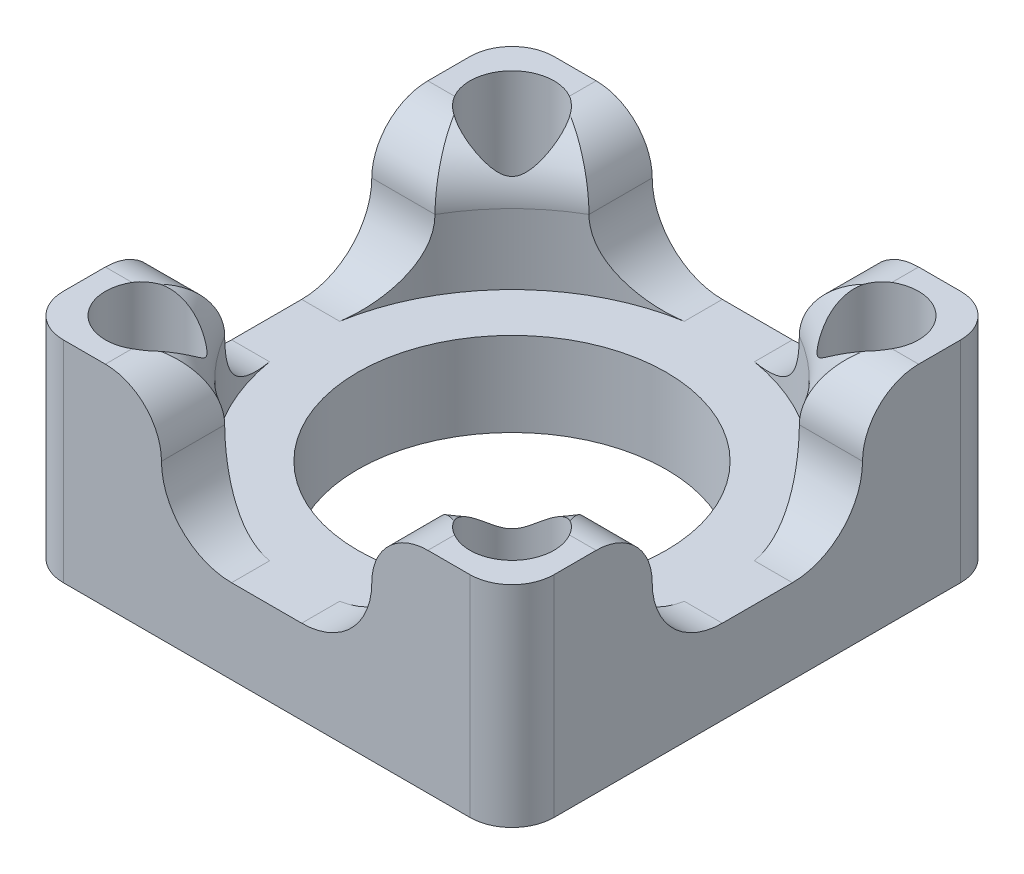
from build123d import *

# Parameters (mm, degrees)
SKETCH1_W                      = 35
SKETCH1_H                      = 35
BOSS_EXTRUDE1_DEPTH            = 6
FILLET1_R                      = 3
CUT_EXTRUDE1_REACH             = 36.916
SKETCH2_R                      = 2.25
CUT_EXTRUDE1_DIRECTION_2_DEPTH = 35.915958162
CUT_EXTRUDE2_REACH             = 36.916
SKETCH3_R                      = 11
BOSS_EXTRUDE2_START            = 9
SKETCH4_R                      = 15
SKETCH4_R_2                    = 2.25
BOSS_EXTRUDE2_DEPTH            = 9
SKETCH5_W                      = 15
SKETCH5_H                      = 9
CUT_EXTRUDE3_DEPTH             = 44.447559692
SKETCH6_W                      = 15
SKETCH6_H                      = 9
CUT_EXTRUDE4_DEPTH             = 47.855455297
FILLET2_R                      = 4
FILLET3_R                      = 5
SKETCH7_R                      = 3
CUT_EXTRUDE5_DEPTH             = 9


# Some blends are built 0.0001 mm under size
with BuildPart() as part:
    # Sketch1 → Boss-Extrude1 (new body)
    with BuildSketch(Plane(origin=(0, 0, 0), x_dir=(1, 0, 0), z_dir=(0, 1, 0))):
        with Locations((-3.421052632, -9.802631579)):
            Rectangle(SKETCH1_W, SKETCH1_H)
    extrude(amount=BOSS_EXTRUDE1_DEPTH)

    # Fillet1
    fillet1_edges = [part.edges().sort_by_distance(p)[0] for p in [
        (-20.921052632, 3, -7.697368421),
        (14.078947368, 3, -7.697368421),
        (14.078947368, 3, 27.302631579),
        (-20.921052632, 3, 27.302631579),
    ]]
    fillet(fillet1_edges, radius=FILLET1_R)

    # Sketch2 → Cut-Extrude1 (cut, up to next)
    with BuildSketch(Plane(origin=(0, 6, 0), x_dir=(1, 0, 0), z_dir=(0, 1, 0)), mode=Mode.PRIVATE) as cut_extrude1_sk1:
        with Locations(Location((-16.421052632, 3.197368421, 0), (0, 0, 90))):
            Circle(SKETCH2_R)
    cut_extrude1_tool1 = extrude(cut_extrude1_sk1.sketch, amount=-CUT_EXTRUDE1_REACH, mode=Mode.PRIVATE) & part.part
    # Sketch2 → Cut-Extrude1 (cut, up to next)
    with BuildSketch(Plane(origin=(0, 6, 0), x_dir=(1, 0, 0), z_dir=(0, 1, 0)), mode=Mode.PRIVATE) as cut_extrude1_sk2:
        with Locations(Location((9.578947368, 3.197368421, 0), (0, 0, 90))):
            Circle(SKETCH2_R)
    cut_extrude1_tool2 = extrude(cut_extrude1_sk2.sketch, amount=-CUT_EXTRUDE1_REACH, mode=Mode.PRIVATE) & part.part
    # Sketch2 → Cut-Extrude1 (cut, up to next)
    with BuildSketch(Plane(origin=(0, 6, 0), x_dir=(1, 0, 0), z_dir=(0, 1, 0)), mode=Mode.PRIVATE) as cut_extrude1_sk3:
        with Locations(Location((9.578947368, -22.802631579, 0), (0, 0, 90))):
            Circle(SKETCH2_R)
    cut_extrude1_tool3 = extrude(cut_extrude1_sk3.sketch, amount=-CUT_EXTRUDE1_REACH, mode=Mode.PRIVATE) & part.part
    # Sketch2 → Cut-Extrude1 (cut, up to next)
    with BuildSketch(Plane(origin=(0, 6, 0), x_dir=(1, 0, 0), z_dir=(0, 1, 0)), mode=Mode.PRIVATE) as cut_extrude1_sk4:
        with Locations(Location((-16.421052632, -22.802631579, 0), (0, 0, 90))):
            Circle(SKETCH2_R)
    cut_extrude1_tool4 = extrude(cut_extrude1_sk4.sketch, amount=-CUT_EXTRUDE1_REACH, mode=Mode.PRIVATE) & part.part
    add(cut_extrude1_tool1.solids().sort_by_distance((-16.421053, 6, -3.197368))[0], mode=Mode.SUBTRACT)
    add(cut_extrude1_tool2.solids().sort_by_distance((9.578947, 6, -3.197368))[0], mode=Mode.SUBTRACT)
    add(cut_extrude1_tool3.solids().sort_by_distance((9.578947, 6, 22.802632))[0], mode=Mode.SUBTRACT)
    add(cut_extrude1_tool4.solids().sort_by_distance((-16.421053, 6, 22.802632))[0], mode=Mode.SUBTRACT)

    # Sketch2 → Cut-Extrude1 direction 2 (cut)
    with BuildSketch(Plane(origin=(0, 6, 0), x_dir=(1, 0, 0), z_dir=(0, 1, 0))):
        with Locations(Location((-16.421052632, 3.197368421, 0), (0, 0, 90))):
            Circle(SKETCH2_R)
        with Locations(Location((9.578947368, 3.197368421, 0), (0, 0, 90))):
            Circle(SKETCH2_R)
        with Locations(Location((9.578947368, -22.802631579, 0), (0, 0, 90))):
            Circle(SKETCH2_R)
        with Locations(Location((-16.421052632, -22.802631579, 0), (0, 0, 90))):
            Circle(SKETCH2_R)
    extrude(amount=CUT_EXTRUDE1_DIRECTION_2_DEPTH, mode=Mode.SUBTRACT)

    # Sketch3 → Cut-Extrude2 (cut, up to next)
    with BuildSketch(Plane(origin=(0, 6, 0), x_dir=(1, 0, 0), z_dir=(0, 1, 0)), mode=Mode.PRIVATE) as cut_extrude2_sk1:
        with Locations(Location((-3.421052632, -9.802631579, 0), (0, 0, 270))):
            Circle(SKETCH3_R)
    cut_extrude2_tool1 = extrude(cut_extrude2_sk1.sketch, amount=-CUT_EXTRUDE2_REACH, mode=Mode.PRIVATE) & part.part
    add(cut_extrude2_tool1.solids().sort_by_distance((-3.421053, 6, 9.802632))[0], mode=Mode.SUBTRACT)

    # Sketch4 → Boss-Extrude2 (add)
    with BuildSketch(Plane(origin=(0, 6, 0), x_dir=(1, 0, 0), z_dir=(0, 1, 0)).offset(BOSS_EXTRUDE2_START)):
        with BuildLine():
            Line((11.078947368, 7.697368421), (-17.921052632, 7.697368421))
            ThreePointArc((-17.921052632, 7.697368421), (-20.042372975, 6.818688765), (-20.921052632, 4.697368421))
            Line((-20.921052632, 4.697368421), (-20.921052632, -24.302631579))
            ThreePointArc((-20.921052632, -24.302631579), (-20.042372975, -26.423951923), (-17.921052632, -27.302631579))
            Line((-17.921052632, -27.302631579), (11.078947368, -27.302631579))
            ThreePointArc((11.078947368, -27.302631579), (13.200267712, -26.423951923), (14.078947368, -24.302631579))
            Line((14.078947368, -24.302631579), (14.078947368, 4.697368421))
            ThreePointArc((14.078947368, 4.697368421), (13.200267712, 6.818688765), (11.078947368, 7.697368421))
        make_face()
        with Locations(Location((-3.421052632, -9.802631579, 0), (0, 0, 270))):
            Circle(SKETCH4_R, mode=Mode.SUBTRACT)
        with Locations(Location((9.578947368, 3.197368421, 0), (0, 0, 90))):
            Circle(SKETCH4_R_2, mode=Mode.SUBTRACT)
        with Locations(Location((9.578947368, -22.802631579, 0), (0, 0, 90))):
            Circle(SKETCH4_R_2, mode=Mode.SUBTRACT)
        with Locations(Location((-16.421052632, -22.802631579, 0), (0, 0, 90))):
            Circle(SKETCH4_R_2, mode=Mode.SUBTRACT)
        with Locations(Location((-16.421052632, 3.197368421, 0), (0, 0, 90))):
            Circle(SKETCH4_R_2, mode=Mode.SUBTRACT)
    extrude(amount=-BOSS_EXTRUDE2_DEPTH)

    # Sketch5 → Cut-Extrude3 (cut, through all)
    with BuildSketch(Plane.XY.offset(27.302631579)):
        with Locations((-3.421052632, 10.5)):
            Rectangle(SKETCH5_W, SKETCH5_H)
    extrude(amount=-CUT_EXTRUDE3_DEPTH, mode=Mode.SUBTRACT)

    # Sketch6 → Cut-Extrude4 (cut, through all)
    with BuildSketch(Plane.ZY.offset(20.921052632)):
        with Locations((9.802631579, 10.5)):
            Rectangle(SKETCH6_W, SKETCH6_H)
    extrude(amount=-CUT_EXTRUDE4_DEPTH, mode=Mode.SUBTRACT)

    # Fillet2
    # the kernel refuses this fillet: 4 mm, written as the material it takes off along each edge
    with BuildSketch(Plane(origin=(-10.921052632, 15, 6.812250522), x_dir=(-1, 0, 0), z_dir=(0, 0, -1)), Plane(origin=(4.078947368, 15, 6.812250522), x_dir=(0, -1, 0), z_dir=(0, 0, -1)), Plane(origin=(-0.430671575, 15, 17.302631579), x_dir=(0, -1, 0), z_dir=(1, 0, 0))) as fillet2_piece_1:
        with BuildLine():
            CenterArc((FILLET2_R, -FILLET2_R), FILLET2_R, 90, 90)
            Line((0, -FILLET2_R), (0, 0))
            Line((0, 0), (FILLET2_R, 0))
        make_face()
    extrude(amount=24.509618943, mode=Mode.SUBTRACT)
    with BuildSketch(Plane(origin=(4.078947368, 15, 37.302631579), x_dir=(1, 0, 0), z_dir=(0, 0, -1)), Plane(origin=(-10.921052632, 15, 37.302631579), x_dir=(0, -1, 0), z_dir=(0, 0, -1)), Plane(origin=(-30.921052632, 15, 2.302631579), x_dir=(0, -1, 0), z_dir=(1, 0, 0)), Plane(origin=(-30.921052632, 15, 17.302631579), x_dir=(0, 0, 1), z_dir=(1, 0, 0)), Plane(origin=(-0.430671575, 15, 2.302631579), x_dir=(0, -1, 0), z_dir=(1, 0, 0))) as fillet2_piece_2:
        with BuildLine():
            CenterArc((FILLET2_R, FILLET2_R), FILLET2_R, 180, 90)
            Line((0, FILLET2_R), (0, 0))
            Line((0, 0), (FILLET2_R, 0))
        make_face()
    extrude(amount=24.509618943, mode=Mode.SUBTRACT)
    with BuildSketch(Plane(origin=(-3.421052632, 15, 9.802631579), x_dir=(0.9897789918574593, 0, 0.14260977272835004), z_dir=(-0.14260977272835004, 0, 0.9897789918574593))) as fillet2_piece_3:
        with BuildLine():
            CenterArc((15 + FILLET2_R, -FILLET2_R), FILLET2_R, 90, 90)
            Line((15 + FILLET2_R, 0), (15, 0))
            Line((15, 0), (15, -FILLET2_R))
        make_face()
    revolve(axis=Axis((-3.421052632, 15, 9.802631579), (0, 1, 0)), revolution_arc=106.397781637, mode=Mode.SUBTRACT)
    with BuildSketch(Plane(origin=(-3.421052632, 15, 9.802631579), x_dir=(-0.9897789918574601, 0, -0.14260977272834405), z_dir=(0.14260977272834405, 0, -0.9897789918574601))) as fillet2_piece_4:
        with BuildLine():
            CenterArc((15 + FILLET2_R, -FILLET2_R), FILLET2_R, 90, 90)
            Line((15 + FILLET2_R, 0), (15, 0))
            Line((15, 0), (15, -FILLET2_R))
        make_face()
    revolve(axis=Axis((-3.421052632, 15, 9.802631579), (0, 1, 0)), revolution_arc=106.397781637, mode=Mode.SUBTRACT)
    with BuildSketch(Plane(origin=(-3.421052632, 15, 9.802631579), x_dir=(-0.14260977272837175, 0, 0.9897789918574561), z_dir=(-0.9897789918574561, 0, -0.14260977272837175))) as fillet2_piece_5:
        with BuildLine():
            CenterArc((15 + FILLET2_R, -FILLET2_R), FILLET2_R, 90, 90)
            Line((15 + FILLET2_R, 0), (15, 0))
            Line((15, 0), (15, -FILLET2_R))
        make_face()
    revolve(axis=Axis((-3.421052632, 15, 9.802631579), (0, 1, 0)), revolution_arc=106.397781637, mode=Mode.SUBTRACT)
    with BuildSketch(Plane(origin=(-3.421052632, 15, 9.802631579), x_dir=(0.14260977272838132, 0, -0.9897789918574547), z_dir=(0.9897789918574547, 0, 0.14260977272838132))) as fillet2_piece_6:
        with BuildLine():
            CenterArc((15 + FILLET2_R, -FILLET2_R), FILLET2_R, 90, 90)
            Line((15 + FILLET2_R, 0), (15, 0))
            Line((15, 0), (15, -FILLET2_R))
        make_face()
    revolve(axis=Axis((-3.421052632, 15, 9.802631579), (0, 1, 0)), revolution_arc=106.397781637, mode=Mode.SUBTRACT)

    # Fillet3
    fillet3_edges = [part.edges().sort_by_distance(p)[0] for p in [
        (-10.921052632, 6, 25.047822107),
        (-18.66624316, 6, 17.302631579),
        (-10.921052632, 6, -5.442558949),
        (11.824137897, 6, 17.302631579),
        (4.078947368, 6, 25.047822107),
        (11.824137897, 6, 2.302631579),
        (4.078947368, 6, -5.442558949),
        (-18.66624316, 6, 2.302631579),
    ]]
    fillet(fillet3_edges, radius=FILLET3_R - 0.0001)  # a hair under: the kernel refuses the full size

    # Sketch7 → Cut-Extrude5 (cut)
    with BuildSketch(Plane(origin=(0, 15, 0), x_dir=(1, 0, 0), z_dir=(0, 1, 0))):
        with Locations(Location((9.578947368, -22.802631579, 0), (0, 0, 270))):
            Circle(SKETCH7_R)
        with Locations(Location((-16.421052632, -22.802631579, 0), (0, 0, 270))):
            Circle(SKETCH7_R)
        with Locations(Location((9.578947368, 3.197368421, 0), (0, 0, 270))):
            Circle(SKETCH7_R)
        with Locations(Location((-16.421052632, 3.197368421, 0), (0, 0, 270))):
            Circle(SKETCH7_R)
    extrude(amount=-CUT_EXTRUDE5_DEPTH, mode=Mode.SUBTRACT)


solid = part.part
